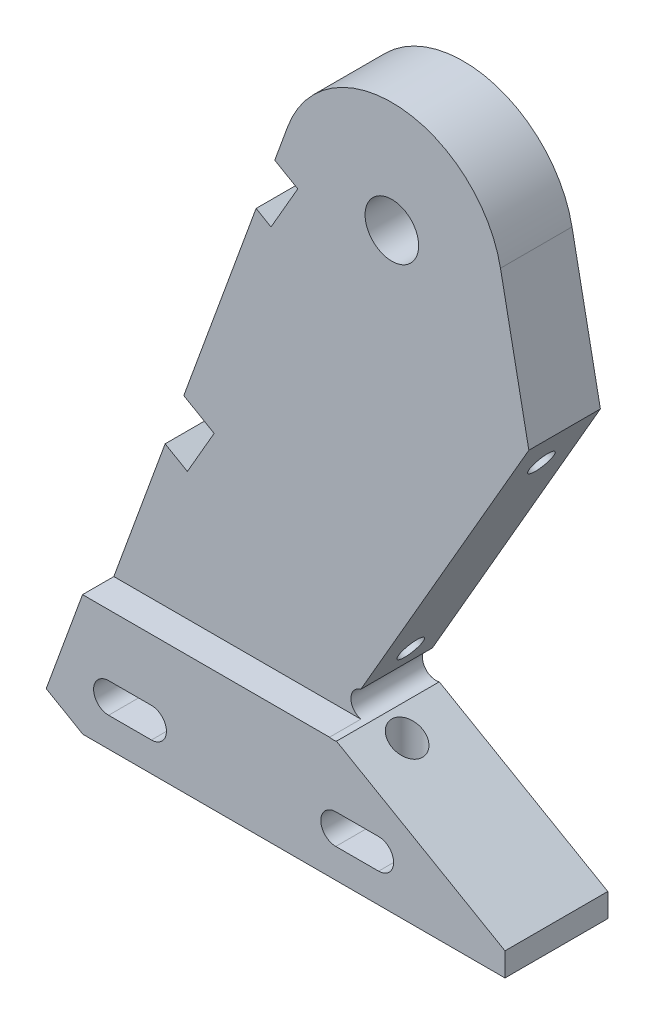
from build123d import *

# Parameters (mm, degrees)
MODEL_R                   = 3.175
BOSS_EXTRUDE1_DEPTH       = 8.4836
BOSS_EXTRUDE2_DEPTH       = 3.7084
F_4_CLEARANCE_HOLE3_D     = 2.9464
F_4_CLEARANCE_HOLE4_D     = 2.9464
CUT_EXTRUDE1_DEPTH        = 60.573404892
F_6_CLEARANCE_HOLE1_D     = 3.6576
F_6_CLEARANCE_HOLE1_DEPTH = 14.326172531
F_6_CLEARANCE_HOLE1_TIP   = 1.0988539


with BuildPart() as part:
    # Model → Boss-Extrude1 (new body)
    with BuildSketch(Plane.XY):
        with BuildLine():
            Line((30.032015577, -29.521189504), (30.032015577, -26.729824585))
            Line((30.032015577, -26.729824585), (10.04882977, -15.19252688))
            ThreePointArc((10.04882977, -15.19252688), (8.104547287, -14.069994865), (9.227079302, -12.125712382))
            Line((9.227079302, -12.125712382), (29.151876156, 22.3850481))
            Line((29.151876156, 22.3850481), (25.790540116, 39.397524407))
            ThreePointArc((25.790540116, 39.397524407), (13.922877184, 49.944916766), (0.570865514, 41.353485372))
            Line((0.570865514, 41.353485372), (-0.979565285, 37.104375313))
            Line((-0.979565285, 37.104375313), (1.753621818, 35.526369004))
            Line((1.753621818, 35.526369004), (-1.421378182, 30.02710769))
            Line((-1.421378182, 30.02710769), (-3.189468587, 31.047915161))
            Line((-3.189468587, 31.047915161), (-11.768069595, 7.537404491))
            Line((-11.768069595, 7.537404491), (-8.165923931, 5.457704722))
            Line((-8.165923931, 5.457704722), (-11.34077003, -0.041645446))
            Line((-11.34077003, -0.041645446), (-13.977972897, 1.480944339))
            Line((-13.977972897, 1.480944339), (-24.373743148, -27.00969967))
            Line((-24.373743148, -27.00969967), (-20.022585807, -29.521189504))
            Line((-20.022585807, -29.521189504), (30.032015577, -29.521189504))
        make_face()
        with Locations((12.90743615, 36.852072417)):
            Circle(MODEL_R, mode=Mode.SUBTRACT)
    extrude(amount=BOSS_EXTRUDE1_DEPTH)

    # Sketch2 → Boss-Extrude2 (add)
    with BuildSketch(Plane.XY.offset(8.4836)):
        with BuildLine():
            Line((-20.062967478, -15.195589504), (9.227391231, -15.192610427))
            ThreePointArc((9.227391231, -15.192610427), (9.638115998, -15.246619623), (10.04882977, -15.19252688))
            Line((10.04882977, -15.19252688), (30.032015577, -26.729824585))
            Line((30.032015577, -26.729824585), (30.032015577, -29.521189504))
            Line((30.032015577, -29.521189504), (-20.022585807, -29.521189504))
            Line((-20.022585807, -29.521189504), (-24.373743148, -27.00969967))
            Line((-24.373743148, -27.00969967), (-20.062967478, -15.195589504))
        make_face()
    extrude(amount=BOSS_EXTRUDE2_DEPTH)

    # #4 Clearance Hole3 (through all)
    with Locations(Plane(origin=(-14.068152667, 8.12225173, 0), x_dir=(0, 0, 1), z_dir=(-0.8660254037844389, 0.4999999999999996, 0))):
        with Locations((4.2418, 28.46854897)):
            Hole(F_4_CLEARANCE_HOLE3_D / 2)

    # #4 Clearance Hole4 (through all)
    with Locations(Plane(origin=(-8.487819953, 4.900128422, 0), x_dir=(0, 0, 1), z_dir=(-0.8660393963332388, 0.49997576341134725, 0))):
        with Locations((4.2418, -2.53117675)):
            Hole(F_4_CLEARANCE_HOLE4_D / 2)

    # Sketch12 → Cut-Extrude1 (cut, through all)
    with BuildSketch(Plane(origin=(0, 0, 0), x_dir=(-1, 0, 0), z_dir=(0, 0, -1))):
        with BuildLine():
            Line((-15.046182511, -22.485389504), (-9.966182511, -22.485389504))
            ThreePointArc((-9.966182511, -22.485389504), (-8.188182511, -24.263389504), (-9.966182511, -26.041389504))
            Line((-9.966182511, -26.041389504), (-15.046182511, -26.041389504))
            ThreePointArc((-15.046182511, -26.041389504), (-16.824182511, -24.263389504), (-15.046182511, -22.485389504))
        make_face()
        with BuildLine():
            Line((11.894585807, -22.485389504), (16.974585807, -22.485389504))
            ThreePointArc((16.974585807, -22.485389504), (18.752585807, -24.263389504), (16.974585807, -26.041389504))
            Line((16.974585807, -26.041389504), (11.894585807, -26.041389504))
            ThreePointArc((11.894585807, -26.041389504), (10.116585807, -24.263389504), (11.894585807, -22.485389504))
        make_face()
    extrude(amount=-CUT_EXTRUDE1_DEPTH, mode=Mode.SUBTRACT)

    # #6 Clearance Hole1
    with Locations(Plane(origin=(0, -29.521189504, 0), x_dir=(-1, 0, 0), z_dir=(0, -1, 0))):
        with Locations((14.433829056, -6.27141583), (-12.506939307, -6.27141583)):
            Hole(F_6_CLEARANCE_HOLE1_D / 2, depth=F_6_CLEARANCE_HOLE1_DEPTH)
            with Locations((0, 0, -(F_6_CLEARANCE_HOLE1_DEPTH + F_6_CLEARANCE_HOLE1_TIP / 2))):  # 118° drill point
                Cone(0, F_6_CLEARANCE_HOLE1_D / 2, F_6_CLEARANCE_HOLE1_TIP, mode=Mode.SUBTRACT)


solid = part.part
